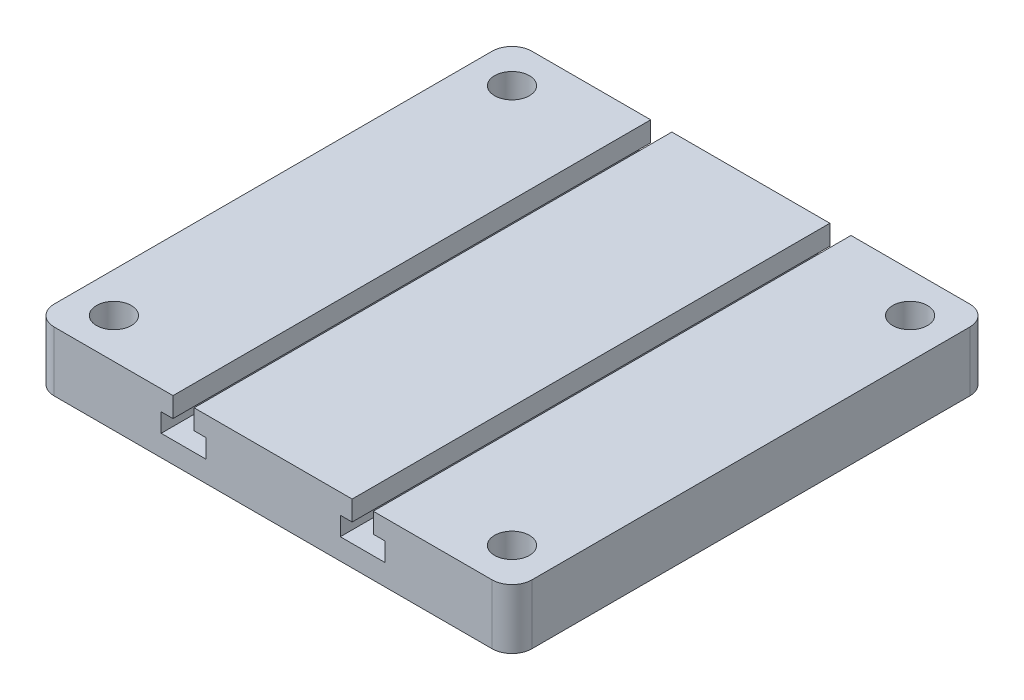
from build123d import *

# Parameters (mm, degrees)
SKETCH1_W                                        = 152.4
SKETCH1_H                                        = 152.4
BOSS_EXTRUDE1_DEPTH                              = 19.05
CBORE_FOR_1_4_SOCKET_HEAD_CAP_SCREW1_D           = 6.5278
CBORE_FOR_1_4_SOCKET_HEAD_CAP_SCREW1_CBORE_D     = 11.1125
CBORE_FOR_1_4_SOCKET_HEAD_CAP_SCREW1_CBORE_DEPTH = 8.89
T_SLOT_CUT_WITH_MCMASTER_8789A16_BIT_DEPTH       = 172.45
FILLET1_R                                        = 6.35


with BuildPart() as part:
    # Sketch1 → Boss-Extrude1 (new body)
    with BuildSketch(Plane(origin=(0, 0, 0), x_dir=(1, 0, 0), z_dir=(0, 1, 0))):
        Rectangle(SKETCH1_W, SKETCH1_H)
    extrude(amount=BOSS_EXTRUDE1_DEPTH)

    # CBORE for 1/4 Socket Head Cap Screw1 (through all)
    with Locations(Plane(origin=(0, 19.05, 0), x_dir=(1, 0, 0), z_dir=(0, 1, 0))):
        with Locations((-63.5, 63.5), (63.5, 63.5), (63.5, -63.5), (-63.5, -63.5)):
            CounterBoreHole(CBORE_FOR_1_4_SOCKET_HEAD_CAP_SCREW1_D / 2, CBORE_FOR_1_4_SOCKET_HEAD_CAP_SCREW1_CBORE_D / 2, CBORE_FOR_1_4_SOCKET_HEAD_CAP_SCREW1_CBORE_DEPTH)

    # Sketch4 → T-SLOT CUT WITH MCMASTER 8789A16 BIT (cut, through all)
    with BuildSketch(Plane.XY.offset(76.2)):
        Polygon((-31.9484375, 19.05), (-31.9484375, 12.7), (-35.71875, 12.7), (-35.71875, 6.746875), (-21.43125, 6.746875), (-21.43125, 12.7), (-25.2015625, 12.7), (-25.2015625, 19.05), align=None)
        Polygon((25.2015625, 12.7), (25.2015625, 19.05), (31.9484375, 19.05), (31.9484375, 12.7), (35.71875, 12.7), (35.71875, 6.746875), (21.43125, 6.746875), (21.43125, 12.7), align=None)
    extrude(amount=-T_SLOT_CUT_WITH_MCMASTER_8789A16_BIT_DEPTH, mode=Mode.SUBTRACT)

    # Fillet1
    fillet1_edges = [part.edges().sort_by_distance(p)[0] for p in [
        (-76.2, 9.525, 76.2),
        (76.2, 9.525, 76.2),
        (76.2, 9.525, -76.2),
        (-76.2, 9.525, -76.2),
    ]]
    fillet(fillet1_edges, radius=FILLET1_R)


solid = part.part
